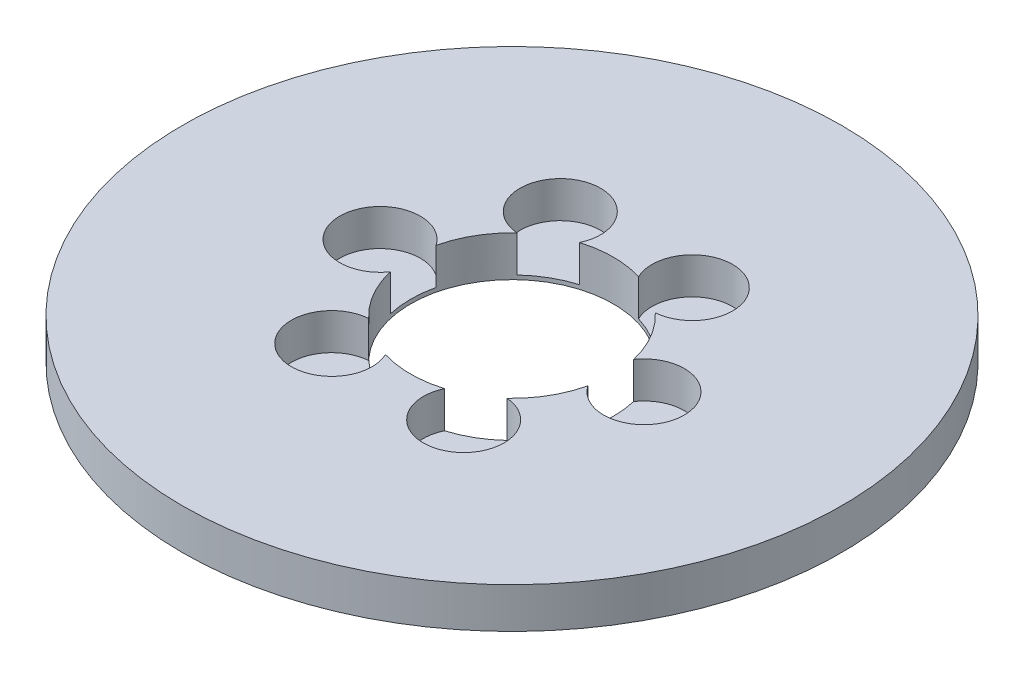
from build123d import *

# Parameters (mm, degrees)
SKETCH1_R           = 32.5
BOSS_EXTRUDE1_DEPTH = 4
SKETCH2_R           = 10
CUT_EXTRUDE1_DEPTH  = 47.135669498
SKETCH3_R           = 3.977832355
CUT_EXTRUDE2_DEPTH  = 3.597140877
CIRPATTERN1_COUNT   = 6


with BuildPart() as part:
    # Sketch1 → Boss-Extrude1 (new body)
    with BuildSketch(Plane(origin=(0, 0, 0), x_dir=(1, 0, 0), z_dir=(0, 1, 0))):
        Circle(SKETCH1_R)
    extrude(amount=BOSS_EXTRUDE1_DEPTH)

    # Sketch2 → Cut-Extrude1 (cut, through all)
    with BuildSketch(Plane(origin=(0, 0, 0), x_dir=(1, 0, 0), z_dir=(0, 1, 0))):
        Circle(SKETCH2_R)
    extrude(amount=CUT_EXTRUDE1_DEPTH, mode=Mode.SUBTRACT)

    # Sketch3 → Cut-Extrude2 (cut)
    with BuildSketch(Plane(origin=(0, 4, 0), x_dir=(1, 0, 0), z_dir=(0, 1, 0))):
        with Locations((-13.015568084, 0)):
            Circle(SKETCH3_R)
    cut_extrude2 = extrude(amount=-CUT_EXTRUDE2_DEPTH, mode=Mode.SUBTRACT)

    # CirPattern1: Cut-Extrude2 ×6 about axis
    cirpattern1_axis = Axis((0, 0, 0), (0, 1, 0))
    for i in range(1, CIRPATTERN1_COUNT):
        add(cut_extrude2.rotate(cirpattern1_axis, i * 360 / CIRPATTERN1_COUNT), mode=Mode.SUBTRACT)


solid = part.part
